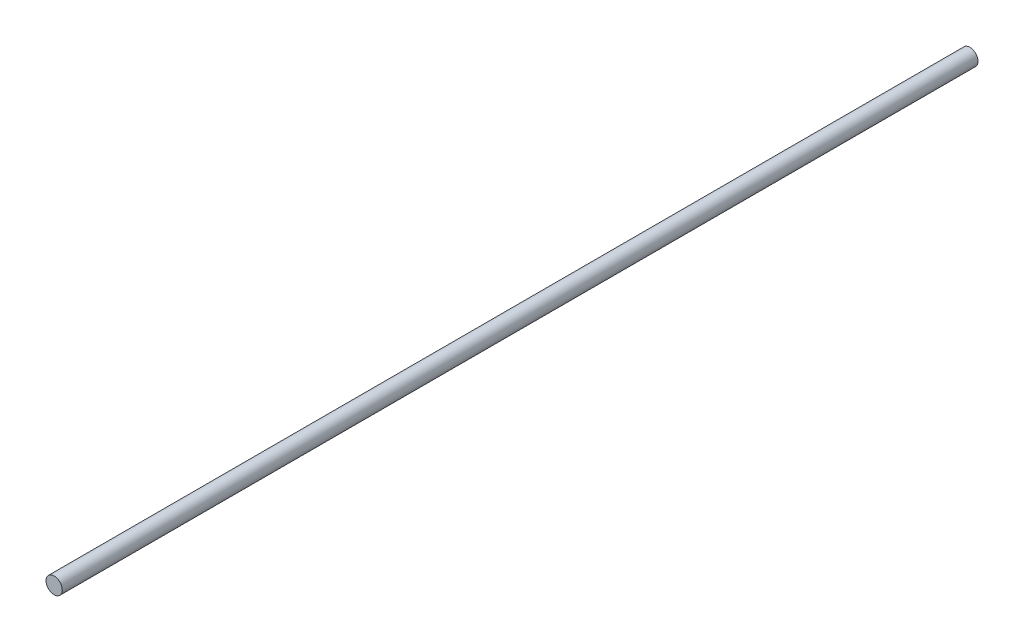
from build123d import *

# Parameters (mm, degrees)
SKETCH1_R             = 4
BOSS_EXTRUDE1_DEPTH   = 450
CROQUIS1_W            = 2
CROQUIS1_H            = 12
CORTAR_EXTRUIR1_DEPTH = 10


with BuildPart() as part:
    # Sketch1 → Boss-Extrude1 (new body)
    with BuildSketch(Plane.XY):
        Circle(SKETCH1_R)
    extrude(amount=-BOSS_EXTRUDE1_DEPTH)

    # Croquis1 → Cortar-Extruir1 (cut)
    with BuildSketch(Plane(origin=(0, 0, -450), x_dir=(-1, 0, 0), z_dir=(0, 0, -1))):
        with Locations((4, 0.404948668)):
            Rectangle(CROQUIS1_W, CROQUIS1_H)
    extrude(amount=-CORTAR_EXTRUIR1_DEPTH, mode=Mode.SUBTRACT)


solid = part.part
